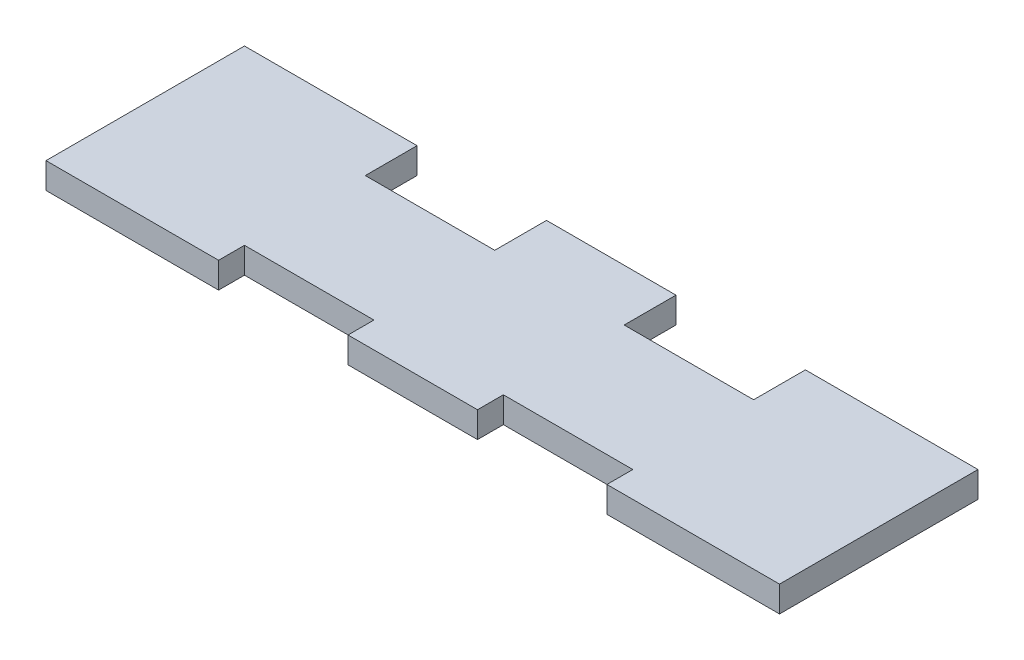
from build123d import *

# Parameters (mm, degrees)
SALIENTE_EXTRUIR1_DEPTH = 3


with BuildPart() as part:
    # Croquis1 → Saliente-Extruir1 (new body)
    with BuildSketch(Plane(origin=(0, 0, 0), x_dir=(1, 0, 0), z_dir=(0, 1, 0))):
        Polygon((0, 0), (20, 0), (20, 3), (35, 3), (35, 0), (50, 0), (50, 3), (65, 3), (65, 0), (85, 0), (85, 23), (65, 23), (65, 17), (50, 17), (50, 23), (35, 23), (35, 17), (20, 17), (20, 23), (0, 23), align=None)
    extrude(amount=SALIENTE_EXTRUIR1_DEPTH)


solid = part.part
